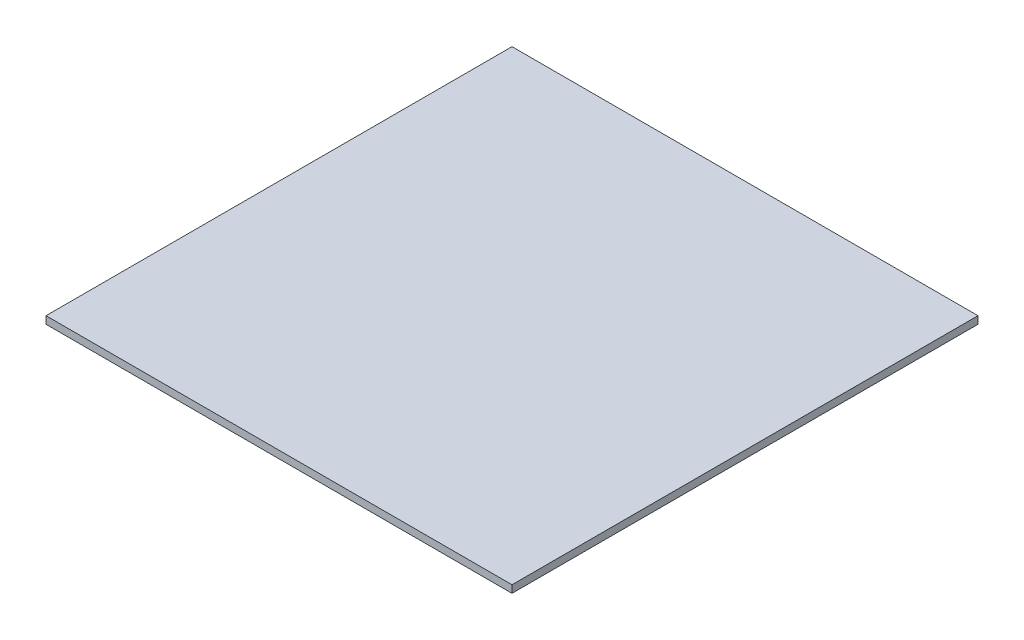
from build123d import *

# Parameters (mm, degrees)
SKETCH1_W           = 250.000000126
SKETCH1_H           = 250.000000126
BOSS_EXTRUDE1_DEPTH = 4.000000128


with BuildPart() as part:
    # Sketch1 → Boss-Extrude1 (new body)
    with BuildSketch(Plane(origin=(0, 0, 0), x_dir=(1, 0, 0), z_dir=(0, 1, 0))):
        with Locations((125.000000063, 125.000000063)):
            Rectangle(SKETCH1_W, SKETCH1_H)
    extrude(amount=BOSS_EXTRUDE1_DEPTH)


solid = part.part
